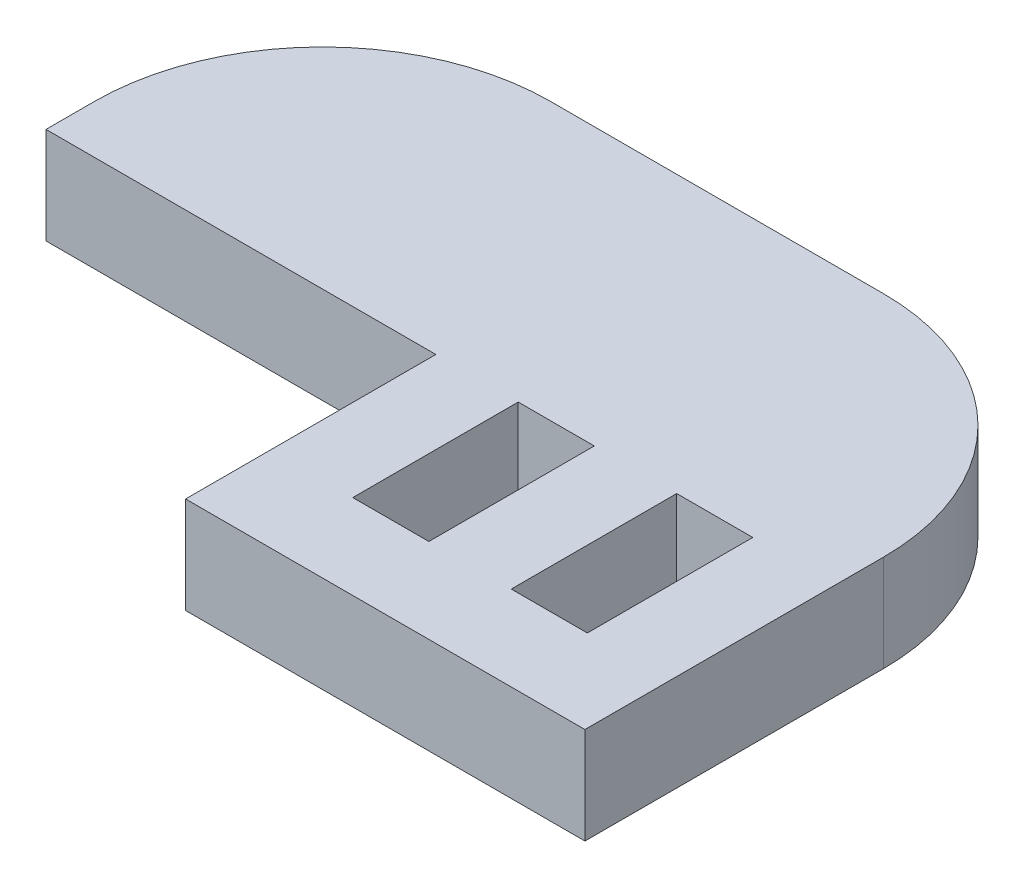
from build123d import *

# Parameters (mm, degrees)
SIDEBUMPERS_START       = -58.795147929
SIDEBUMPERS_OUTLINE_W   = 5.08
SIDEBUMPERS_OUTLINE_H   = 12.7
SIDEBUMPERS_DEPTH       = 21
SIDEBUMPERS_START_2     = -79.295147929
SIDEBUMPERS_2_OUTLINE_W = 5.08
SIDEBUMPERS_2_OUTLINE_H = 2.54
SIDEBUMPERS_2_DEPTH     = 62
SKETCH3_W               = 20.5
SKETCH3_H               = 5.08
CUT_EXTRUDE1_DEPTH      = 5.08
SKETCH5_W               = 21
SKETCH5_H               = 5.08
BOSS_EXTRUDE1_DEPTH     = 3
SKETCH8_W               = 41.5
SKETCH8_H               = 5.08
BOSS_EXTRUDE3_DEPTH     = 12
FILLET2_R               = 12
SKETCH9_W               = 4
SKETCH9_H               = 8.7
CUT_EXTRUDE5_DEPTH      = 5.08


# Read off the part's stored shape, not the designer's step: SideBumpers
with BuildPart() as part:
    # SideBumpers outline → SideBumpers (new body)
    with BuildSketch(Plane.YZ.offset(SIDEBUMPERS_START)):
        with Locations((-9.174171779, 10.734849265)):
            Rectangle(SIDEBUMPERS_OUTLINE_W, SIDEBUMPERS_OUTLINE_H)
    extrude(amount=SIDEBUMPERS_DEPTH)

    # SideBumpers 2 outline → SideBumpers 2 (add)
    with BuildSketch(Plane.YZ.offset(SIDEBUMPERS_START_2)):
        with Locations((-9.174171779, 5.654849265)):
            Rectangle(SIDEBUMPERS_2_OUTLINE_W, SIDEBUMPERS_2_OUTLINE_H)
    extrude(amount=SIDEBUMPERS_2_DEPTH)

    # Sketch3 → Cut-Extrude1 (cut)
    with BuildSketch(Plane(origin=(0, 0, 4.384849265), x_dir=(-1, 0, 0), z_dir=(0, 0, -1))):
        with Locations((27.545147929, -9.174171779)):
            Rectangle(SKETCH3_W, SKETCH3_H)
    extrude(amount=-CUT_EXTRUDE1_DEPTH, mode=Mode.SUBTRACT)

    # Sketch5 → Boss-Extrude1 (add)
    with BuildSketch(Plane.XY.offset(17.084849265)):
        with Locations((-48.295147929, -9.174171779)):
            Rectangle(SKETCH5_W, SKETCH5_H)
    extrude(amount=BOSS_EXTRUDE1_DEPTH)

    # Sketch8 → Boss-Extrude3 (add)
    with BuildSketch(Plane(origin=(0, 0, 4.384849265), x_dir=(-1, 0, 0), z_dir=(0, 0, -1))):
        with Locations((58.545147929, -9.174171779)):
            Rectangle(SKETCH8_W, SKETCH8_H)
    extrude(amount=BOSS_EXTRUDE3_DEPTH)

    # Fillet2
    fillet2_edges = [part.edges().sort_by_distance(p)[0] for p in [
        (-79.295147929, -9.174171779, -7.615150735),
        (-37.795147929, -9.174171779, -7.615150735),
    ]]
    fillet(fillet2_edges, radius=FILLET2_R)

    # Sketch9 → Cut-Extrude5 (cut)
    with BuildSketch(Plane(origin=(0, -6.634171779, 0), x_dir=(1, 0, 0), z_dir=(0, 1, 0))):
        with Locations((-44.128481262, -11.274849265)):
            Rectangle(SKETCH9_W, SKETCH9_H)
        with Locations((-52.461814595, -11.274849265)):
            Rectangle(SKETCH9_W, SKETCH9_H)
    extrude(amount=-CUT_EXTRUDE5_DEPTH, mode=Mode.SUBTRACT)


solid = part.part
